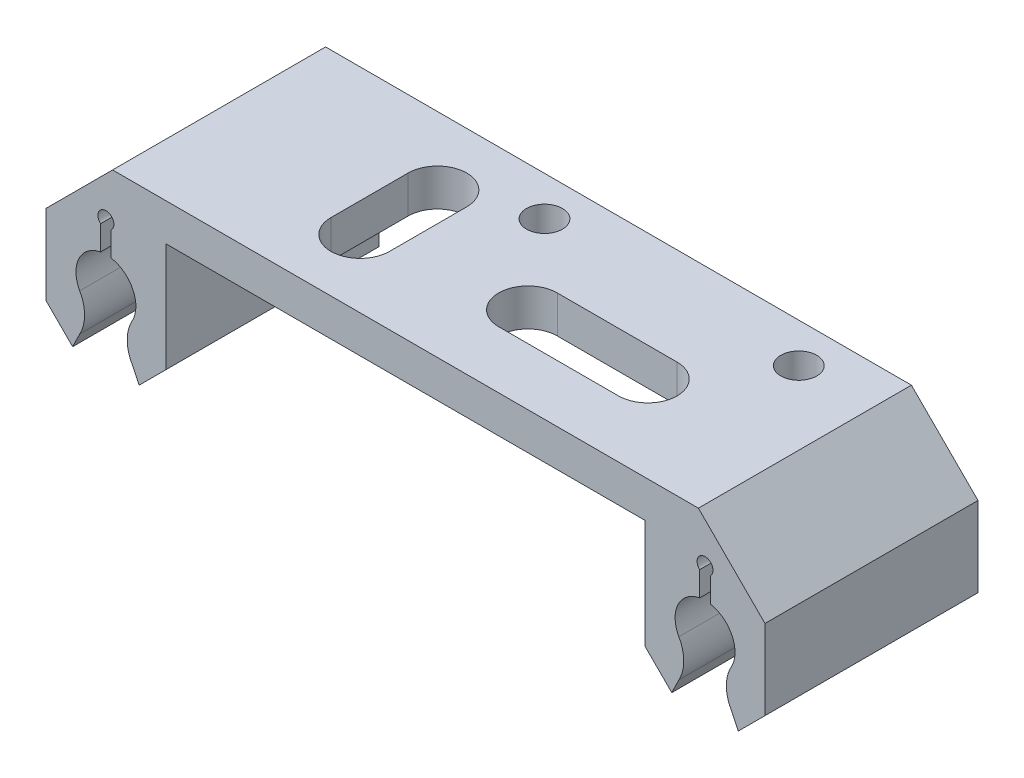
from build123d import *

# Parameters (mm, degrees)
BOSS_EXTRUDE1_DEPTH = 16
CHAMFER1_SIZE       = 2
SKETCH2_R           = 2.25
CUT_EXTRUDE1_DEPTH  = 16
CUT_EXTRUDE2_DEPTH  = 16
SKETCH5_R           = 1.35
CUT_EXTRUDE3_DEPTH  = 16
CHAMFER3_SIZE       = 5


with BuildPart() as part:
    # Sketch1 → Boss-Extrude1 (new body)
    with BuildSketch(Plane.XY):
        Polygon((0, 0), (0, 13), (54, 13), (54, 0), (45, 0), (45, 10.2), (9, 10.2), (9, 0), align=None)
    extrude(amount=BOSS_EXTRUDE1_DEPTH)

    # Chamfer1
    chamfer1_edges = [part.edges().sort_by_distance(p)[0] for p in [
        (54, 0, 8),
        (45, 0, 8),
        (0, 0, 8),
        (9, 0, 8),
    ]]
    chamfer(chamfer1_edges, length=CHAMFER1_SIZE)

    # Sketch2 → Cut-Extrude1 (cut)
    with BuildSketch(Plane.XY.offset(16)):
        with Locations((4.5, 5)):
            Circle(SKETCH2_R)
        with Locations((49.5, 5)):
            Circle(SKETCH2_R)
    extrude(amount=-CUT_EXTRUDE1_DEPTH, mode=Mode.SUBTRACT)

    # Sketch3 → Cut-Extrude2 (cut)
    with BuildSketch(Plane.XY.offset(16)):
        with BuildLine():
            Line((2.534938179, 3.904083927), (6.465061821, 3.904083927))
            ThreePointArc((6.465061821, 3.904083927), (6.1, 2.5), (6.465061821, 1.095916073))
            Line((6.465061821, 1.095916073), (7, 0))
            Line((7, 0), (2, 0))
            Line((2, 0), (2.534938179, 1.095916073))
            ThreePointArc((2.534938179, 1.095916073), (2.9, 2.5), (2.534938179, 3.904083927))
        make_face()
        with BuildLine():
            Line((4.1, 9.052786405), (4.1, 6.794596967))
            Line((4.1, 6.794596967), (4.9, 6.794596967))
            Line((4.9, 6.794596967), (4.9, 9.052786405))
            ThreePointArc((4.9, 9.052786405), (4.5, 10.1), (4.1, 9.052786405))
        make_face()
    cut_extrude2 = extrude(amount=-CUT_EXTRUDE2_DEPTH, mode=Mode.SUBTRACT)

    # Mirror1: Cut-Extrude2 across plane
    add(cut_extrude2.mirror(Plane(origin=(27, 0, 0), x_dir=(0, 0, 1), z_dir=(1, 0, 0))), mode=Mode.SUBTRACT)

    # Sketch5 → Cut-Extrude3 (cut)
    with BuildSketch(Plane(origin=(0, 13, 0), x_dir=(1, 0, 0), z_dir=(0, 1, 0))):
        with Locations((24.4, -2.96)):
            Circle(SKETCH5_R)
        with Locations((43.5, -2.96)):
            Circle(SKETCH5_R)
        with BuildLine():
            Line((20.7, -5.1), (20.7, -10.9))
            ThreePointArc((20.7, -10.9), (18.5, -13.1), (16.3, -10.9))
            Line((16.3, -10.9), (16.3, -5.1))
            ThreePointArc((16.3, -5.1), (18.5, -2.9), (20.7, -5.1))
        make_face()
        with BuildLine():
            Line((29.7, -7.3), (38.7, -7.3))
            ThreePointArc((38.7, -7.3), (40.9, -9.5), (38.7, -11.7))
            Line((38.7, -11.7), (29.7, -11.7))
            ThreePointArc((29.7, -11.7), (27.5, -9.5), (29.7, -7.3))
        make_face()
    extrude(amount=-CUT_EXTRUDE3_DEPTH, mode=Mode.SUBTRACT)

    # Chamfer3
    chamfer3_edges = [part.edges().sort_by_distance(p)[0] for p in [
        (54, 13, 8),
        (0, 13, 8),
    ]]
    chamfer(chamfer3_edges, length=CHAMFER3_SIZE)


solid = part.part
